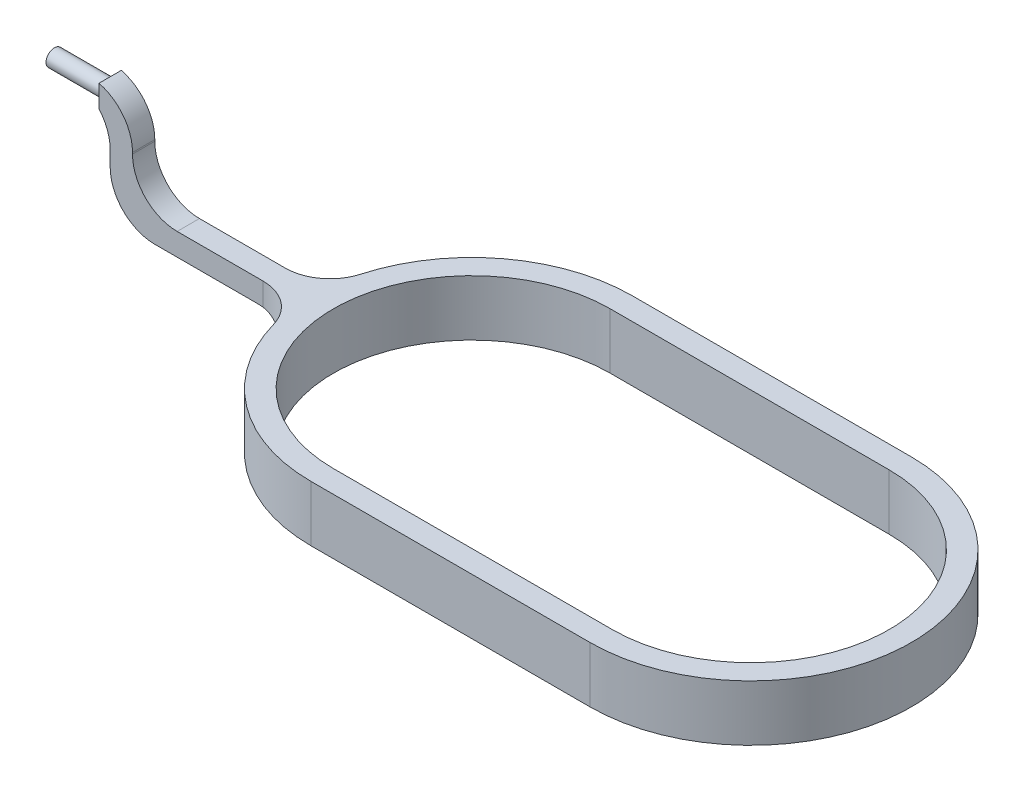
from build123d import *

# Parameters (mm, degrees)
BOSS_EXTRUDE1_DEPTH      = 5
BOSS_EXTRUDE2_DEPTH      = 1
BOSS_EXTRUDE2_DEPTH_BACK = 1
SKETCH4_W                = 2
SKETCH4_H                = 1
SKETCH4_W_2              = 17
SKETCH4_H_2              = 2
SKETCH5_R                = 0.75
BOSS_EXTRUDE3_DEPTH      = 5
FILLET1_R                = 4


with BuildPart() as part:
    # Sketch1 → Boss-Extrude1 (new body)
    with BuildSketch(Plane(origin=(0, 0, 0), x_dir=(1, 0, 0), z_dir=(0, 1, 0))):
        with BuildLine():
            Line((0, 14.4), (25, 14.4))
            ThreePointArc((25, 14.4), (39.4, 0), (25, -14.4))
            Line((25, -14.4), (0, -14.4))
            ThreePointArc((0, -14.4), (-14.4, 0), (0, 14.4))
        make_face()
        with BuildLine():
            Line((0, 12.4), (25, 12.4))
            ThreePointArc((25, 12.4), (37.4, 0), (25, -12.4))
            Line((25, -12.4), (0, -12.4))
            ThreePointArc((0, -12.4), (-12.4, 0), (0, 12.4))
        make_face(mode=Mode.SUBTRACT)
    extrude(amount=BOSS_EXTRUDE1_DEPTH)

    # Sketch4 → Boss-Extrude2 (add, two sides: drawn at the far end of the back side and taken through both)
    with BuildSketch(Plane.XY.offset(-BOSS_EXTRUDE2_DEPTH_BACK)):
        Polygon((-31.4, 12), (-29.4, 12), (-29.4, 13), (-32.4, 13), (-32.4, 11), (-31.4, 11), align=None)
        with Locations((-30.4, 11.5)):
            Rectangle(SKETCH4_W, SKETCH4_H)
        Polygon((-29.4, 3), (-29.4, 5), (-29.4, 11), (-31.4, 11), (-31.4, 3), align=None)
        with Locations((-20.9, 4)):
            Rectangle(SKETCH4_W_2, SKETCH4_H_2)
    extrude(amount=BOSS_EXTRUDE2_DEPTH + BOSS_EXTRUDE2_DEPTH_BACK)

    # Sketch5 → Boss-Extrude3 (add)
    with BuildSketch(Plane.ZY.offset(32.4)):
        with Locations((0, 12)):
            Circle(SKETCH5_R)
    extrude(amount=BOSS_EXTRUDE3_DEPTH)

    # Fillet1
    # the kernel refuses this fillet: 4 mm, written as the material it adds along each edge
    with BuildSketch(Plane(origin=(-14.365235814, 5, -1), x_dir=(0.17149804582148126, 0, -0.9851844600273663), z_dir=(0, -1, 0))) as fillet1_piece_1:
        with BuildLine():
            CenterArc((3.367524545, -3.978862537), FILLET1_R, 95.892851455, 74.232218513)
            Line((-0.573213295, -3.292870354), (-0.652028052, -3.27915051))
            Line((-0.652028052, -3.27915051), (-0.078814757, 0.013719844))
            Line((-0.078814757, 0.013719844), (0.008213474, 0.079577251))
            ThreePointArc((0.008213474, 0.079577251), (1.47842541, 0.003905135), (2.948637345, 0.079577251))
            Line((2.948637345, 0.079577251), (2.95685082, 0))
        make_face()
    extrude(amount=2)
    with BuildSketch(Plane(origin=(-14.365235814, 5, 1), x_dir=(0.17149804582148112, 0, 0.9851844600273663), z_dir=(0, -1, 0))) as fillet1_piece_2:
        with BuildLine():
            CenterArc((3.367524545, 3.978862537), FILLET1_R, 189.874930032, 74.232218513)
            Line((-0.573213295, 3.292870354), (-0.652028052, 3.27915051))
            Line((-0.652028052, 3.27915051), (-0.078814757, -0.013719844))
            Line((-0.078814757, -0.013719844), (0.008213474, -0.079577251))
            ThreePointArc((0.008213474, -0.079577251), (1.47842541, -0.003905135), (2.948637345, -0.079577251))
            Line((2.948637345, -0.079577251), (2.95685082, 0))
        make_face()
    extrude(amount=2)
    with BuildSketch(Plane(origin=(0, 3, 0), x_dir=(-0.7371891614816782, 0, 0.6756864214959037), z_dir=(0.6756864214959037, 0, 0.7371891614816782))) as fillet1_piece_3_section:
        with BuildLine():
            CenterArc((18.272983346, 4), FILLET1_R, 194.477512186, 75.522487814)
            Line((18.272983346, 0), (18.272983346, -0.08))
            Line((18.272983346, -0.08), (14.4, -0.08))
            Line((14.4, -0.08), (14.32, 0))
            ThreePointArc((14.32, 0), (14.32, 1.5), (14.322540333, 2.98))
            Line((14.322540333, 2.98), (14.4, 3))
        make_face()
    fillet1_piece_3 = revolve(axis=Axis((0, 3, 0), (0, -1, 0)), revolution_arc=85.014954966, mode=Mode.PRIVATE)
    fillet1_piece_3 = split(fillet1_piece_3, bisect_by=Plane(origin=(-15.301586286, 2.241601932, -1), z_dir=(0, 0, 1)), keep=Keep.TOP, mode=Mode.PRIVATE)
    fillet1_piece_3 = split(fillet1_piece_3, bisect_by=Plane(origin=(-15.301586286, 2.241601932, 1), z_dir=(0, 0, -1)), keep=Keep.TOP, mode=Mode.PRIVATE)
    add(fillet1_piece_3)
    with BuildSketch(Plane(origin=(-29.4, 5, 1), x_dir=(1, 0, 0), z_dir=(0, 0, -1))) as fillet1_piece_4:
        with BuildLine():
            CenterArc((FILLET1_R, -FILLET1_R), FILLET1_R, 90, 90)
            Line((0, -FILLET1_R), (-FILLET1_R * 0.02, -FILLET1_R))
            Line((-FILLET1_R * 0.02, -FILLET1_R), (-FILLET1_R * 0.02, FILLET1_R * 0.02))
            Line((-FILLET1_R * 0.02, FILLET1_R * 0.02), (FILLET1_R, FILLET1_R * 0.02))
            Line((FILLET1_R, FILLET1_R * 0.02), (FILLET1_R, 0))
        make_face()
    extrude(amount=2)
    with BuildSketch(Plane(origin=(-31.4, 11, -1), x_dir=(0, -1, 0), z_dir=(0, 0, 1))) as fillet1_piece_5:
        with BuildLine():
            CenterArc((2.645751311, -4), FILLET1_R, 90, 41.409622109)
            Line((0, -1), (-0.052915026, -0.94))
            ThreePointArc((-0.052915026, -0.94), (-0.08, -0.5), (-0.08, 0))
            Line((-0.08, 0), (0, 0.08))
            Line((0, 0.08), (2.645751311, 0.08))
            Line((2.645751311, 0.08), (2.645751311, 0))
        make_face()
    extrude(amount=2)
    with BuildSketch(Plane(origin=(-14.365235814, 5, -1), x_dir=(0.17149804582148126, 0, -0.9851844600273663), z_dir=(0, -1, 0))) as fillet1_piece_6a_section:
        with BuildLine():
            CenterArc((3.367524545, -3.978862537), FILLET1_R, 95.892851455, 74.232218513)
            Line((-0.573213295, -3.292870354), (-0.652028052, -3.27915051))
            Line((-0.652028052, -3.27915051), (-0.078814757, 0.013719844))
            Line((-0.078814757, 0.013719844), (0.008213474, 0.079577251))
            ThreePointArc((0.008213474, 0.079577251), (1.47842541, 0.003905135), (2.948637345, 0.079577251))
            Line((2.948637345, 0.079577251), (2.95685082, 0))
        make_face()
    fillet1_piece_6a = extrude(amount=10.355974154, mode=Mode.PRIVATE)
    fillet1_piece_6a = split(fillet1_piece_6a, bisect_by=Plane(origin=(-15.057221624, 0, -1.646357347), z_dir=(0, 1, 0)), keep=Keep.TOP, mode=Mode.PRIVATE)
    fillet1_piece_6a = split(fillet1_piece_6a, bisect_by=Plane(origin=(-15.057221624, 3, -1.646357347), z_dir=(0, -1, 0)), keep=Keep.TOP, mode=Mode.PRIVATE)
    with BuildSketch(Plane(origin=(0, 3, 0), x_dir=(-0.7371891614816782, 0, 0.6756864214959037), z_dir=(0.6756864214959037, 0, 0.7371891614816782))) as fillet1_piece_6b_section:
        with BuildLine():
            CenterArc((18.272983346, 4), FILLET1_R, 194.477512186, 75.522487814)
            Line((18.272983346, 0), (18.272983346, -0.08))
            Line((18.272983346, -0.08), (14.4, -0.08))
            Line((14.4, -0.08), (14.32, 0))
            ThreePointArc((14.32, 0), (14.32, 1.5), (14.322540333, 2.98))
            Line((14.322540333, 2.98), (14.4, 3))
        make_face()
    fillet1_piece_6b = revolve(axis=Axis((0, 3, 0), (0, -1, 0)), revolution_arc=85.014954966, mode=Mode.PRIVATE)
    fillet1_piece_6b = split(fillet1_piece_6b, bisect_by=Plane(origin=(-13.861423807, 2.266551545, -1), z_dir=(0, 0, -1)), keep=Keep.TOP, mode=Mode.PRIVATE)
    fillet1_piece_6 = fillet1_piece_6a & fillet1_piece_6b
    add(fillet1_piece_6)
    with BuildSketch(Plane(origin=(0, 3, 0), x_dir=(-0.7371891614816782, 0, 0.6756864214959037), z_dir=(0.6756864214959037, 0, 0.7371891614816782))) as fillet1_piece_7a_section:
        with BuildLine():
            CenterArc((18.272983346, 4), FILLET1_R, 194.477512186, 75.522487814)
            Line((18.272983346, 0), (18.272983346, -0.08))
            Line((18.272983346, -0.08), (14.4, -0.08))
            Line((14.4, -0.08), (14.32, 0))
            ThreePointArc((14.32, 0), (14.32, 1.5), (14.322540333, 2.98))
            Line((14.322540333, 2.98), (14.4, 3))
        make_face()
    fillet1_piece_7a = revolve(axis=Axis((0, 3, 0), (0, -1, 0)), revolution_arc=85.014954966, mode=Mode.PRIVATE)
    fillet1_piece_7a = split(fillet1_piece_7a, bisect_by=Plane(origin=(-13.861424305, 2.266551683, 1), z_dir=(0, 0, 1)), keep=Keep.TOP, mode=Mode.PRIVATE)
    with BuildSketch(Plane(origin=(-14.365235814, 5, 1), x_dir=(0.17149804582148112, 0, 0.9851844600273663), z_dir=(0, -1, 0))) as fillet1_piece_7b_section:
        with BuildLine():
            CenterArc((3.367524545, 3.978862537), FILLET1_R, 189.874930032, 74.232218513)
            Line((-0.573213295, 3.292870354), (-0.652028052, 3.27915051))
            Line((-0.652028052, 3.27915051), (-0.078814757, -0.013719844))
            Line((-0.078814757, -0.013719844), (0.008213474, -0.079577251))
            ThreePointArc((0.008213474, -0.079577251), (1.47842541, -0.003905135), (2.948637345, -0.079577251))
            Line((2.948637345, -0.079577251), (2.95685082, 0))
        make_face()
    fillet1_piece_7b = extrude(amount=10.355974154, mode=Mode.PRIVATE)
    fillet1_piece_7b = split(fillet1_piece_7b, bisect_by=Plane(origin=(-15.057221624, 0, 1.646357347), z_dir=(0, 1, 0)), keep=Keep.TOP, mode=Mode.PRIVATE)
    fillet1_piece_7b = split(fillet1_piece_7b, bisect_by=Plane(origin=(-15.057221624, 3, 1.646357347), z_dir=(0, -1, 0)), keep=Keep.TOP, mode=Mode.PRIVATE)
    fillet1_piece_7 = fillet1_piece_7a & fillet1_piece_7b
    add(fillet1_piece_7)
    # the kernel refuses this fillet: 4 mm, written as the material it takes off along each edge
    with BuildSketch(Plane(origin=(-31.4, 3, -11), x_dir=(1, 0, 0), z_dir=(0, 0, 1))) as fillet1_2_piece_1:
        with BuildLine():
            CenterArc((FILLET1_R, FILLET1_R), FILLET1_R, 180, 90)
            Line((0, FILLET1_R), (-FILLET1_R * 0.02, FILLET1_R))
            Line((-FILLET1_R * 0.02, FILLET1_R), (-FILLET1_R * 0.02, -FILLET1_R * 0.02))
            Line((-FILLET1_R * 0.02, -FILLET1_R * 0.02), (FILLET1_R, -FILLET1_R * 0.02))
            Line((FILLET1_R, -FILLET1_R * 0.02), (FILLET1_R, 0))
        make_face()
    extrude(amount=22, mode=Mode.SUBTRACT)
    with BuildSketch(Plane(origin=(-29.4, 13, -10.682458366), x_dir=(-1, 0, 0), z_dir=(0, 0, 1))) as fillet1_2_piece_2:
        with BuildLine():
            CenterArc((4, 3.872983346), FILLET1_R, 180, 75.522487814)
            Line((0, 3.872983346), (-0.08, 3.872983346))
            Line((-0.08, 3.872983346), (-0.08, 0))
            Line((-0.08, 0), (0, -0.08))
            ThreePointArc((0, -0.08), (1.5, -0.08), (2.98, -0.077459667))
            Line((2.98, -0.077459667), (3, 0))
        make_face()
    extrude(amount=21.364916731, mode=Mode.SUBTRACT)


solid = part.part
